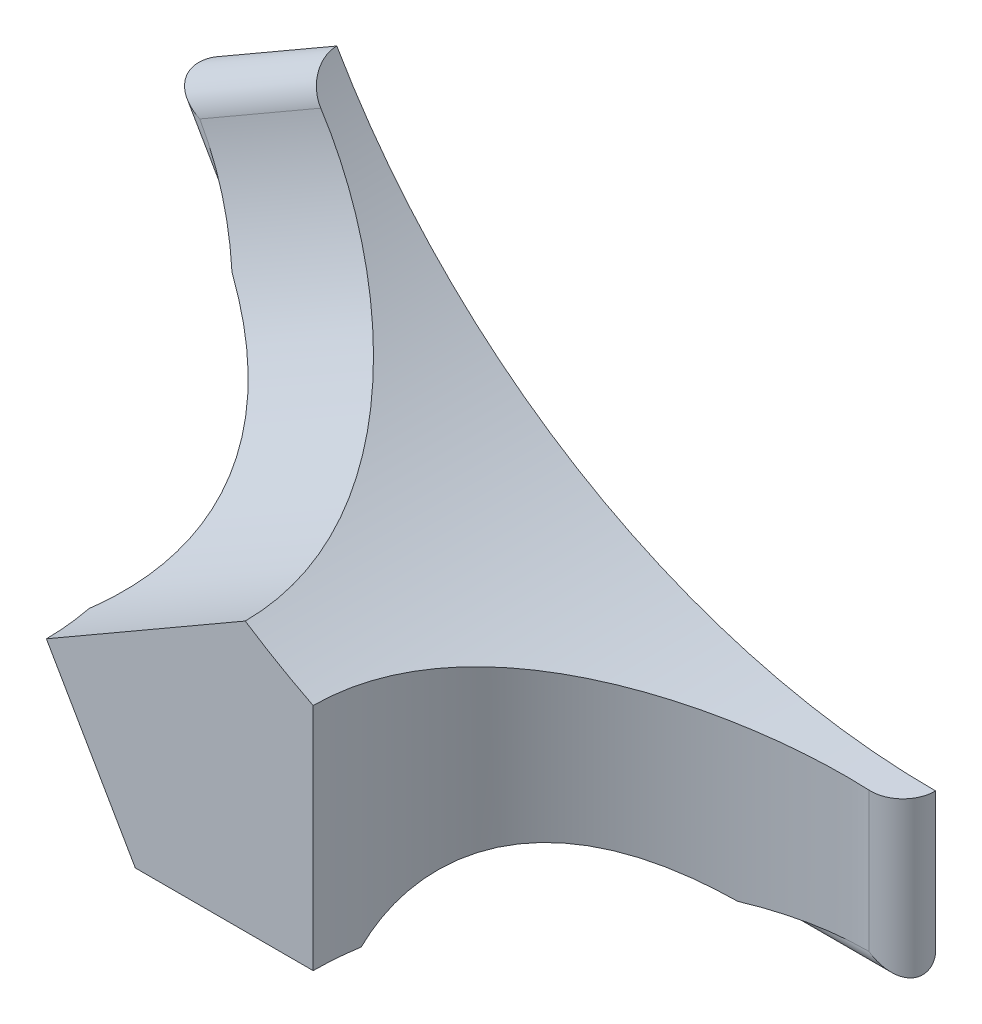
from build123d import *

# Parameters (mm, degrees)
EXTRUDE_494_DEPTH      = 14
CUT_EXTRUDE_1131_DEPTH = 29.36738428
CUT_EXTRUDE_1421_DEPTH = 29.36738428
CUT_EXTRUDE_START      = -3
CUT_EXTRUDE_1834_DEPTH = 32.367384446
CHAMFER_1_SIZE         = 0.5


with BuildPart() as part:
    # Эскиз1 → Extrude 494 (new body)
    with BuildSketch(Plane.XY):
        with BuildLine():
            Line((0, 0), (22, 0))
            Line((22, 0), (22, 7))
            ThreePointArc((22, 7), (13.949403122, 8.059881186), (6.447441117, 11.167295593))
            Line((6.447441117, 11.167295593), (0, 0))
        make_face()
    extrude_494 = extrude(amount=EXTRUDE_494_DEPTH)

    # Эскиз2 → Cut-Extrude 1131 (cut, through all)
    with BuildSketch(Plane(origin=(22, 0, 0), x_dir=(0, 0, -1), z_dir=(1, 0, 0))):
        with BuildLine():
            Line((-14, -1), (0, -1))
            Line((0, -1), (0, 0.75))
            ThreePointArc((0, 0.75), (-0.75, 0), (-1.5, 0.75))
            Line((-1.5, 0.75), (-2.5, 0.75))
            ThreePointArc((-2.5, 0.75), (-7.416188166, 2.480050099), (-12, 0))
            Line((-12, 0), (-14, 0))
            Line((-14, 0), (-14, -1))
        make_face()
    cut_extrude_1131 = extrude(amount=-CUT_EXTRUDE_1131_DEPTH, mode=Mode.SUBTRACT)

    # Эскиз3 → Cut-Extrude 1421 (cut, through all)
    with BuildSketch(Plane(origin=(0, 0, 0), x_dir=(1, 0, 0), z_dir=(0, 1, 0))):
        with BuildLine():
            Line((22, 0), (22, -14))
            Line((22, -14), (8, -14))
            ThreePointArc((8, -14), (11.661165235, -5.161165235), (20.5, -1.5))
            ThreePointArc((20.5, -1.5), (21.560660172, -1.060660172), (22, 0))
        make_face()
    cut_extrude_1421 = extrude(amount=CUT_EXTRUDE_1421_DEPTH, mode=Mode.SUBTRACT)

    # Эскиз5 → Cut-Extrude 1834 (cut)
    with BuildSketch(Plane(origin=(0, 0, 0), x_dir=(-1, 0, 0), z_dir=(0, 0, -1)).offset(CUT_EXTRUDE_START)):
        with BuildLine():
            ThreePointArc((-3.401814855, 5.892116168), (-4.197712007, 5.562444773), (-5.051814855, 5.45))
            Line((-5.051814855, 5.45), (-10.742413779, 5.45))
            Line((-10.742413779, 5.45), (-10.742413779, 4.05))
            Line((-10.742413779, 4.05), (-5.051814855, 4.05))
            ThreePointArc((-5.051814855, 4.05), (-3.835365343, 4.210148616), (-2.701814855, 4.679680602))
            Line((-2.701814855, 4.679680602), (-3.401814855, 5.892116168))
        make_face()
    cut_extrude_1834 = extrude(amount=CUT_EXTRUDE_1834_DEPTH, mode=Mode.SUBTRACT)

    # Зеркальное отражение1: Extrude 494, Cut-Extrude 1131, Cut-Extrude 1421, Cut-Extrude 1834 across plane
    add(extrude_494.mirror(Plane(origin=(6.447441117, 11.167295593, 14), x_dir=(0, 0, 1), z_dir=(0.8660254037844397, -0.4999999999999982, 0))))
    add(cut_extrude_1131.mirror(Plane(origin=(6.447441117, 11.167295593, 14), x_dir=(0, 0, 1), z_dir=(0.8660254037844397, -0.4999999999999982, 0))), mode=Mode.SUBTRACT)
    add(cut_extrude_1421.mirror(Plane(origin=(6.447441117, 11.167295593, 14), x_dir=(0, 0, 1), z_dir=(0.8660254037844397, -0.4999999999999982, 0))), mode=Mode.SUBTRACT)
    add(cut_extrude_1834.mirror(Plane(origin=(6.447441117, 11.167295593, 14), x_dir=(0, 0, 1), z_dir=(0.8660254037844397, -0.4999999999999982, 0))), mode=Mode.SUBTRACT)

    # Фаска1
    chamfer_1_edges = [part.edges().sort_by_distance(p)[0] for p in [
        (10.742413779, 4.75, 0),
        (7.897114317, 5.45, 0),
        (3.401814855, 5.892116168, 0),
        (7.897114317, 4.05, 0),
        (2.701814855, 4.679680602, 0),
        (0.771281292, 9.564101615, 0),
        (-0.441154273, 8.864101615, 0),
        (-1.257586221, 11.67820323, 0),
    ]]
    chamfer(chamfer_1_edges, length=CHAMFER_1_SIZE)


solid = part.part
